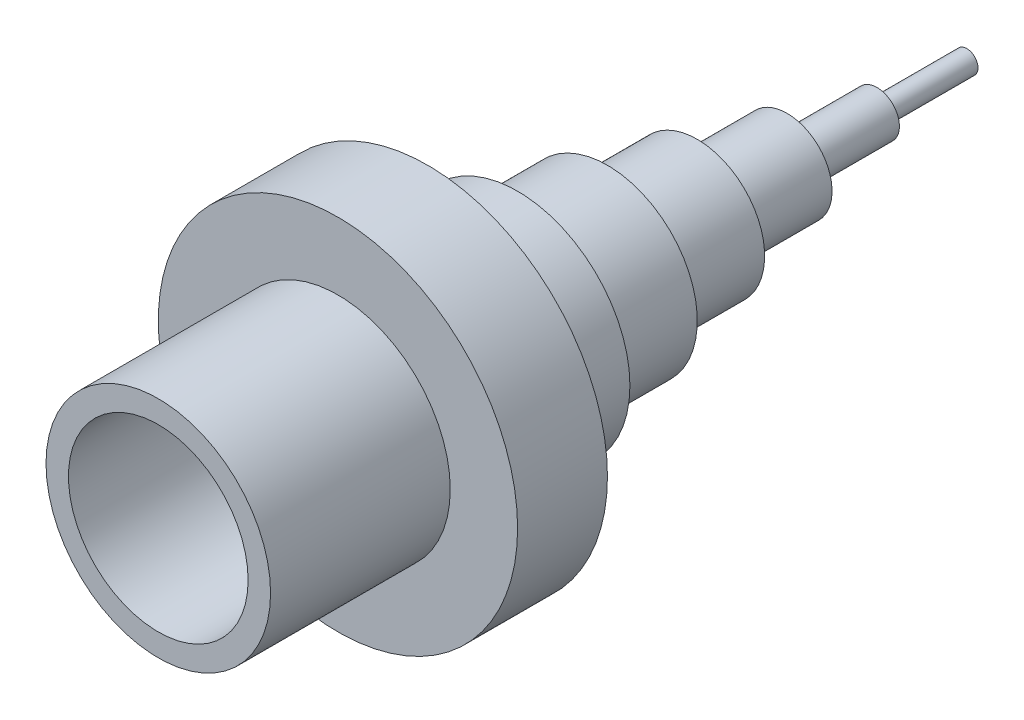
from build123d import *

# Parameters (mm, degrees)
SKETCH1_R            = 40
BOSS_EXTRUDE1_DEPTH  = 20
SKETCH2_R            = 25
SKETCH2_R_2          = 20
BOSS_EXTRUDE2_DEPTH  = 40
BOSS_EXTRUDE5_START  = 20
SKETCH3_R            = 25
BOSS_EXTRUDE5_DEPTH  = 20
BOSS_EXTRUDE6_START  = 20
SKETCH4_R            = 20
BOSS_EXTRUDE6_DEPTH  = 20
SKETCH5_R            = 15
BOSS_EXTRUDE7_DEPTH  = 20
SKETCH6_R            = 10
BOSS_EXTRUDE8_DEPTH  = 20
SKETCH7_R            = 5
BOSS_EXTRUDE9_DEPTH  = 20
SKETCH8_R            = 2.5
BOSS_EXTRUDE10_DEPTH = 20


with BuildPart() as part:
    # Sketch1 → Boss-Extrude1 (new body)
    with BuildSketch(Plane.XY):
        Circle(SKETCH1_R)
    extrude(amount=BOSS_EXTRUDE1_DEPTH)

    # Sketch2 → Boss-Extrude2 (add)
    with BuildSketch(Plane.XY.offset(20)):
        Circle(SKETCH2_R)
        Circle(SKETCH2_R_2, mode=Mode.SUBTRACT)
    extrude(amount=BOSS_EXTRUDE2_DEPTH)

    # Sketch3 → Boss-Extrude5 (add)
    with BuildSketch(Plane(origin=(0, 0, 0), x_dir=(-1, 0, 0), z_dir=(0, 0, -1)).offset(BOSS_EXTRUDE5_START)):
        Circle(SKETCH3_R)
    extrude(amount=-BOSS_EXTRUDE5_DEPTH)

    # Sketch4 → Boss-Extrude6 (add)
    with BuildSketch(Plane(origin=(0, 0, -20), x_dir=(-1, 0, 0), z_dir=(0, 0, -1)).offset(BOSS_EXTRUDE6_START)):
        Circle(SKETCH4_R)
    extrude(amount=-BOSS_EXTRUDE6_DEPTH)

    # Sketch5 → Boss-Extrude7 (add)
    with BuildSketch(Plane(origin=(0, 0, -40), x_dir=(-1, 0, 0), z_dir=(0, 0, -1))):
        Circle(SKETCH5_R)
    extrude(amount=BOSS_EXTRUDE7_DEPTH)

    # Sketch6 → Boss-Extrude8 (add)
    with BuildSketch(Plane(origin=(0, 0, -60), x_dir=(-1, 0, 0), z_dir=(0, 0, -1))):
        Circle(SKETCH6_R)
    extrude(amount=BOSS_EXTRUDE8_DEPTH)

    # Sketch7 → Boss-Extrude9 (add)
    with BuildSketch(Plane(origin=(0, 0, -80), x_dir=(-1, 0, 0), z_dir=(0, 0, -1))):
        Circle(SKETCH7_R)
    extrude(amount=BOSS_EXTRUDE9_DEPTH)

    # Sketch8 → Boss-Extrude10 (add)
    with BuildSketch(Plane(origin=(0, 0, -100), x_dir=(-1, 0, 0), z_dir=(0, 0, -1))):
        Circle(SKETCH8_R)
    extrude(amount=BOSS_EXTRUDE10_DEPTH)


solid = part.part
